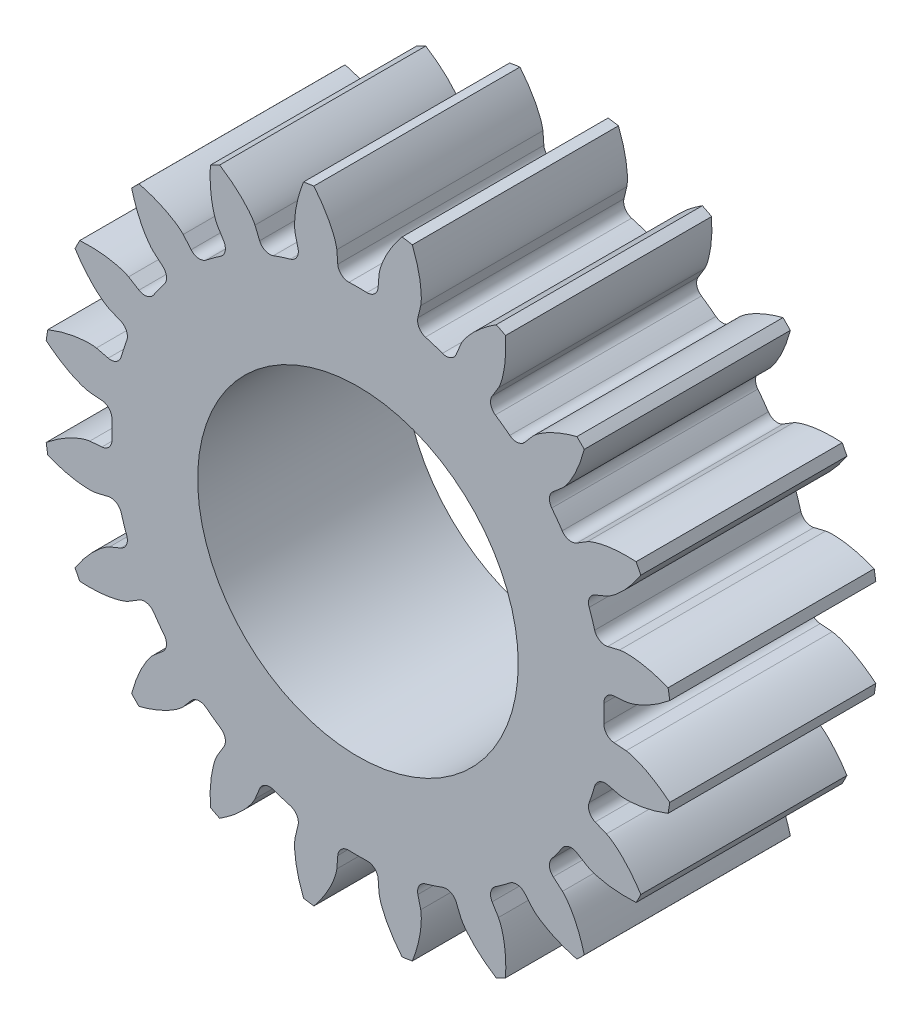
from build123d import *

# Parameters (mm, degrees)
BLANK_SKETCH_R    = 13.75
BLANK_DEPTH       = 9
TOOTH_SPACE_DEPTH = 22.427202337
TEETH_COUNT       = 20
BORE_DEPTH        = 22.253469727
BORE_DEPTH_BACK   = 22.253469727
BORE_SKETCH_R     = 7


with BuildPart() as part:
    # Blank Sketch → Blank (new body)
    with BuildSketch(Plane.XY):
        Circle(BLANK_SKETCH_R)
    extrude(amount=BLANK_DEPTH)

    # Tooth Space Sketch → Tooth Space (cut, symmetric)
    with BuildSketch(Plane.XY):
        with BuildLine():
            Line((11.709860103, 0.922712572), (11.180289267, 0.880983494))
            ThreePointArc((11.180289267, 0.880983494), (10.862988941, 0.723480031), (10.742915644, 0.39020951))
            ThreePointArc((10.742915644, 0.39020951), (10.75, 0), (10.742915644, -0.39020951))
            ThreePointArc((10.742915644, -0.39020951), (10.862988941, -0.723480031), (11.180289267, -0.880983494))
            Line((11.180289267, -0.880983494), (11.709860103, -0.922712572))
            add(Edge.make_bspline(
                [(11.709860103, -0.922712572), (11.715313475, -0.923234617), (11.730580069, -0.924982426), (11.759319753, -0.929405731), (11.80598663, -0.938205714), (11.86506971, -0.951736167), (11.94092317, -0.971871237), (12.029548412, -0.998976801), (12.126085986, -1.032288866), (12.230093072, -1.072304199), (12.332879138, -1.115538905), (12.434437251, -1.161726096), (12.534681177, -1.210479105), (12.654945734, -1.272744636), (12.797491556, -1.351852601), (12.961497116, -1.450701421), (13.144282968, -1.570278326), (13.326873882, -1.699980424), (13.503420438, -1.834000155), (13.677968733, -1.976594979), (13.844122091, -2.119647646), (14.012499078, -2.275384766), (14.16579995, -2.422795632), (14.332640843, -2.595647481), (14.46587003, -2.737409714), (14.599233693, -2.890118061), (14.663505795, -2.96535919), (14.69608147, -3.004195304)],
                knots=[0, 0, 0, 0, 0, 0.005376749, 0.015083688, 0.02853182, 0.046610139, 0.064854849, 0.092110525, 0.119476176, 0.146842496, 0.174208854, 0.201574956, 0.228941013, 0.256307345, 0.307035032, 0.361767352, 0.41649966, 0.471231936, 0.525964282, 0.580696615, 0.635428982, 0.690161387, 0.744893688, 0.799626082, 0.854358408, 0.909090915, 0.909090915, 0.909090915, 0.909090915, 0.909090915], degree=4))
            Line((14.69608147, -3.004195304), (14.69608147, 3.004195304))
            add(Edge.make_bspline(
                [(11.709860103, 0.922712572), (11.715313475, 0.923234617), (11.730580069, 0.924982426), (11.759319753, 0.929405731), (11.80598663, 0.938205714), (11.86506971, 0.951736167), (11.94092317, 0.971871237), (12.029548412, 0.998976801), (12.126085986, 1.032288866), (12.230093072, 1.072304199), (12.332879138, 1.115538905), (12.434437251, 1.161726096), (12.534681177, 1.210479105), (12.654945734, 1.272744636), (12.797491556, 1.351852601), (12.961497116, 1.450701421), (13.144282968, 1.570278326), (13.326873882, 1.699980424), (13.503420438, 1.834000155), (13.677968733, 1.976594979), (13.844122091, 2.119647646), (14.012499078, 2.275384766), (14.16579995, 2.422795632), (14.332640843, 2.595647481), (14.46587003, 2.737409714), (14.599233693, 2.890118061), (14.663505795, 2.96535919), (14.69608147, 3.004195304)],
                knots=[0, 0, 0, 0, 0, 0.005376749, 0.015083688, 0.02853182, 0.046610139, 0.064854849, 0.092110525, 0.119476176, 0.146842496, 0.174208854, 0.201574956, 0.228941013, 0.256307345, 0.307035032, 0.361767352, 0.41649966, 0.471231936, 0.525964282, 0.580696615, 0.635428982, 0.690161387, 0.744893688, 0.799626082, 0.854358408, 0.909090915, 0.909090915, 0.909090915, 0.909090915, 0.909090915], degree=4))
        make_face()
    tooth_space = extrude(amount=TOOTH_SPACE_DEPTH, both=True, mode=Mode.SUBTRACT)

    # Teeth: Tooth Space ×20 about axis
    teeth_axis = Axis((0, 0, -0.25007105), (0, 0, 1))
    for i in range(1, TEETH_COUNT):
        add(tooth_space.rotate(teeth_axis, i * 360 / TEETH_COUNT), mode=Mode.SUBTRACT)

    # Bore Sketch → Bore (cut, two sides: drawn at the far end of the back side and taken through both)
    with BuildSketch(Plane.XY.offset(-BORE_DEPTH_BACK)):
        Circle(BORE_SKETCH_R)
    extrude(amount=BORE_DEPTH + BORE_DEPTH_BACK, mode=Mode.SUBTRACT)


solid = part.part
